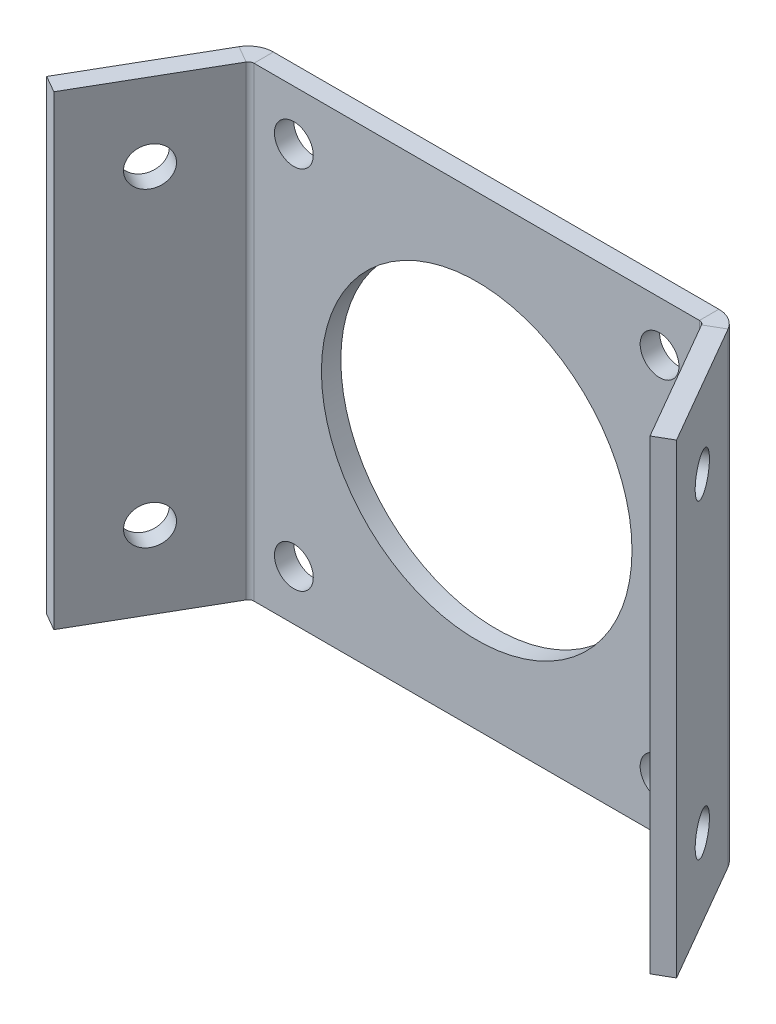
from build123d import *

# Parameters (mm, degrees)
SCHIZZO1_W               = 64
SCHIZZO1_H               = 60
BASE_FLANGIA1_DEPTH      = 2.5
BORDO_FLANGIA1_START     = -30
BORDO_FLANGIA1_DEPTH     = 60
BORDO_FLANGIA1_2_DEPTH   = 60
BORDO_FLANGIA2_START     = -30
BORDO_FLANGIA2_DEPTH     = 60
BORDO_FLANGIA2_2_DEPTH   = 60
SCHIZZO12_R              = 2.5
SCHIZZO12_R_2            = 20
TAGLIO_ESTRUSIONE1_DEPTH = 10
SCHIZZO14_R              = 2.5
TAGLIO_ESTRUSIONE2_DEPTH = 10


# Read off the part's stored shape, not the designer's step: Bordo-Flangia1, Bordo-Flangia2
# Sheet-metal steps are written as plain solids
with BuildPart() as part:
    # Schizzo1 → Base-Flangia1 (new body)
    with BuildSketch(Plane.XY):
        Rectangle(SCHIZZO1_W, SCHIZZO1_H)
    extrude(amount=-BASE_FLANGIA1_DEPTH)

    # Bordo-Flangia1 outline → Bordo-Flangia1 (cut)
    with BuildSketch(Plane(origin=(0, 0, 0), x_dir=(1, 0, 0), z_dir=(0, 1, 0)).offset(BORDO_FLANGIA1_START)):
        with BuildLine():
            ThreePointArc((28.687972446, 2.5), (30.306272446, 2.066377822), (31.490950268, 0.8817))
            Line((31.490950268, 0.8817), (32, 0))
            Line((32, 0), (32, 2.5))
            Line((32, 2.5), (28.687972446, 2.5))
        make_face()
    extrude(amount=BORDO_FLANGIA1_DEPTH, mode=Mode.SUBTRACT)

    # Bordo-Flangia1 2 outline → Bordo-Flangia1 2 (add)
    with BuildSketch(Plane(origin=(0, 0, 0), x_dir=(1, 0, 0), z_dir=(0, 1, 0)).offset(BORDO_FLANGIA1_START)):
        with BuildLine():
            Line((40.556624327, -14.820508076), (32, 0))
            Line((32, 0), (28.687972446, 0))
            ThreePointArc((28.687972446, 0), (29.056272446, -0.098685688), (29.325886758, -0.3683))
            Line((29.325886758, -0.3683), (38.391560818, -16.070508076))
            Line((38.391560818, -16.070508076), (40.556624327, -14.820508076))
        make_face()
    extrude(amount=BORDO_FLANGIA1_2_DEPTH)

    # Bordo-Flangia2 outline → Bordo-Flangia2 (cut)
    with BuildSketch(Plane(origin=(0, 0, 0), x_dir=(1, 0, 0), z_dir=(0, 1, 0)).offset(BORDO_FLANGIA2_START)):
        with BuildLine():
            Line((-32, 0), (-31.490950268, 0.8817))
            ThreePointArc((-31.490950268, 0.8817), (-30.306272446, 2.066377822), (-28.687972446, 2.5))
            Line((-28.687972446, 2.5), (-32, 2.5))
            Line((-32, 2.5), (-32, 0))
        make_face()
    extrude(amount=BORDO_FLANGIA2_DEPTH, mode=Mode.SUBTRACT)

    # Bordo-Flangia2 2 outline → Bordo-Flangia2 2 (add)
    with BuildSketch(Plane(origin=(0, 0, 0), x_dir=(1, 0, 0), z_dir=(0, 1, 0)).offset(BORDO_FLANGIA2_START)):
        with BuildLine():
            Line((-28.687972446, 0), (-32, 0))
            Line((-32, 0), (-40.556624327, -14.820508076))
            Line((-40.556624327, -14.820508076), (-38.391560818, -16.070508076))
            Line((-38.391560818, -16.070508076), (-29.325886758, -0.3683))
            ThreePointArc((-29.325886758, -0.3683), (-29.056272446, -0.098685688), (-28.687972446, 0))
        make_face()
    extrude(amount=BORDO_FLANGIA2_2_DEPTH)

    # Schizzo12 → Taglio-Estrusione1 (cut)
    with BuildSketch(Plane.XY):
        with Locations((-23.55, 23.55)):
            Circle(SCHIZZO12_R)
        with Locations((23.55, 23.55)):
            Circle(SCHIZZO12_R)
        with Locations((23.55, -23.55)):
            Circle(SCHIZZO12_R)
        with Locations((-23.55, -23.55)):
            Circle(SCHIZZO12_R)
        Circle(SCHIZZO12_R_2)
    extrude(amount=-TAGLIO_ESTRUSIONE1_DEPTH, mode=Mode.SUBTRACT)

    # Schizzo14 → Taglio-Estrusione2 (cut)
    with BuildSketch(Plane(origin=(-24, 0, -13.856406461), x_dir=(-0.5000000000000043, 0, 0.8660254037844363), z_dir=(-0.8660254037844362, 0, -0.5000000000000042))):
        with Locations((24.047574595, 20)):
            Circle(SCHIZZO14_R)
        with Locations(Location((24.047574595, -20, 0), (0, 0, 180))):
            Circle(SCHIZZO14_R)
    taglio_estrusione2 = extrude(amount=-TAGLIO_ESTRUSIONE2_DEPTH, mode=Mode.SUBTRACT)

    # Specchia1: Taglio-Estrusione2 across plane
    add(taglio_estrusione2.mirror(Plane(origin=(0, 0, 0), x_dir=(0, 0, 1), z_dir=(1, 0, 0))), mode=Mode.SUBTRACT)


solid = part.part
